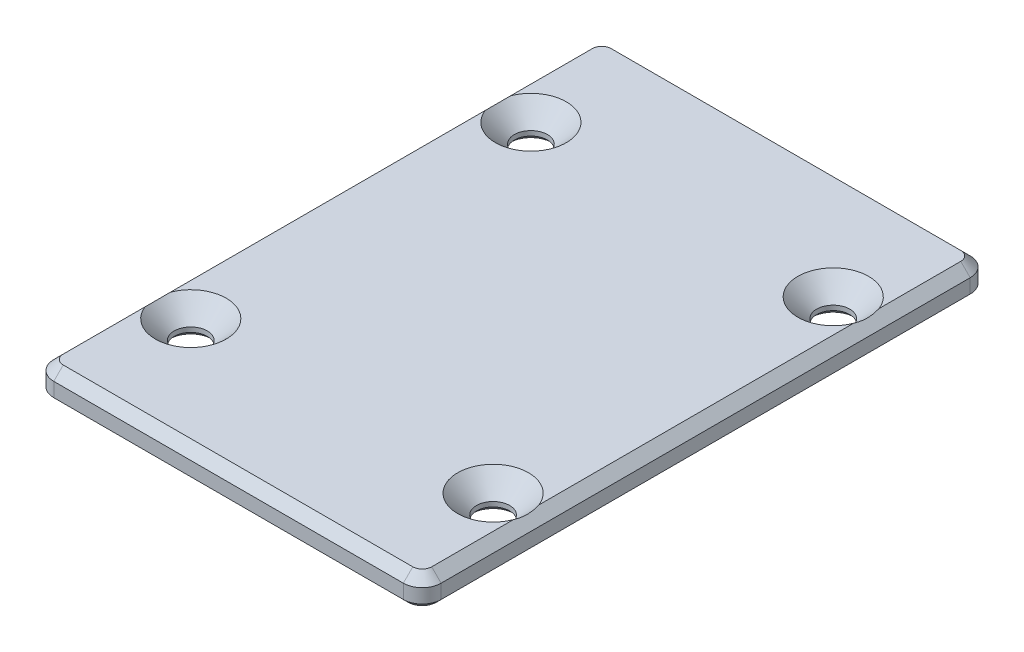
from build123d import *

# Parameters (mm, degrees)
SKETCH_1_W          = 41
SKETCH_1_H          = 60
EXTRUDE_1_DEPTH     = 3
SKETCH_2_R          = 1.75
CUT_EXTRUDE_1_DEPTH = 3
FILLET_1_R          = 2
CHAMFER_2_SIZE      = 1
CHAMFER_1_SIZE      = 2
CHAMFER_3_SIZE      = 0.5


with BuildPart() as part:
    # Эскиз1 → Бобышка-Вытянуть1 (new body)
    with BuildSketch(Plane(origin=(0, 0, 0), x_dir=(1, 0, 0), z_dir=(0, 1, 0))):
        Rectangle(SKETCH_1_W, SKETCH_1_H)
    extrude(amount=EXTRUDE_1_DEPTH)

    # Эскиз2 → Вырез-Вытянуть1 (cut)
    with BuildSketch(Plane(origin=(0, 3, 0), x_dir=(1, 0, 0), z_dir=(0, 1, 0))):
        with Locations(Location((16, 18, 0), (0, 0, 270))):
            Circle(SKETCH_2_R)
        with Locations(Location((16, -18, 0), (0, 0, 90))):
            Circle(SKETCH_2_R)
        with Locations(Location((-16, -18, 0), (0, 0, 270))):
            Circle(SKETCH_2_R)
        with Locations(Location((-16, 18, 0), (0, 0, 90))):
            Circle(SKETCH_2_R)
    extrude(amount=-CUT_EXTRUDE_1_DEPTH, mode=Mode.SUBTRACT)

    # Скругление1
    fillet_1_edges = [part.edges().sort_by_distance(p)[0] for p in [
        (20.5, 1.5, 30),
        (-20.5, 1.5, 30),
        (-20.5, 1.5, -30),
        (20.5, 1.5, -30),
    ]]
    fillet(fillet_1_edges, radius=FILLET_1_R)

    # Фаска2
    chamfer_2_edges = [part.edges().sort_by_distance(p)[0] for p in [
        (0, 3, -30),
        (20.5, 3, 0),
        (-20.5, 3, 0),
        (0, 3, 30),
        (19.914213562, 3, 29.414213562),
        (-19.914213562, 3, 29.414213562),
        (-19.914213562, 3, -29.414213562),
        (19.914213562, 3, -29.414213562),
    ]]
    chamfer(chamfer_2_edges, length=CHAMFER_2_SIZE)

    # Фаска1
    # the kernel refuses this chamfer: 2 mm, written as the material it takes off along each edge
    with BuildSketch(Plane(origin=(-16, 3, -18), x_dir=(0, 0, -1), z_dir=(1, 0, 0))) as chamfer_1_piece_1:
        Polygon((1.75 + CHAMFER_1_SIZE, 0), (1.75, -CHAMFER_1_SIZE), (1.75, 0), align=None)
    revolve(axis=Axis((-16, 3, -18), (0, 1, 0)), mode=Mode.SUBTRACT)
    with BuildSketch(Plane(origin=(-16, 3, 18), x_dir=(0, 0, 1), z_dir=(-1, 0, 0))) as chamfer_1_piece_2:
        Polygon((1.75 + CHAMFER_1_SIZE, 0), (1.75, -CHAMFER_1_SIZE), (1.75, 0), align=None)
    revolve(axis=Axis((-16, 3, 18), (0, 1, 0)), mode=Mode.SUBTRACT)
    with BuildSketch(Plane(origin=(16, 3, 18), x_dir=(0, 0, -1), z_dir=(1, 0, 0))) as chamfer_1_piece_3:
        Polygon((1.75 + CHAMFER_1_SIZE, 0), (1.75, -CHAMFER_1_SIZE), (1.75, 0), align=None)
    revolve(axis=Axis((16, 3, 18), (0, 1, 0)), mode=Mode.SUBTRACT)
    with BuildSketch(Plane(origin=(16, 3, -18), x_dir=(0, 0, 1), z_dir=(-1, 0, 0))) as chamfer_1_piece_4:
        Polygon((1.75 + CHAMFER_1_SIZE, 0), (1.75, -CHAMFER_1_SIZE), (1.75, 0), align=None)
    revolve(axis=Axis((16, 3, -18), (0, 1, 0)), mode=Mode.SUBTRACT)

    # Фаска3
    chamfer_3_edges = [part.edges().sort_by_distance(p)[0] for p in [
        (-16, 0, -16.25),
        (-16, 0, 16.25),
        (16, 0, 19.75),
        (16, 0, -19.75),
        (0, 0, -30),
        (20.5, 0, 0),
        (0, 0, 30),
        (-20.5, 0, 0),
        (19.914213562, 0, 29.414213562),
        (-19.914213562, 0, 29.414213562),
        (-19.914213562, 0, -29.414213562),
        (19.914213562, 0, -29.414213562),
    ]]
    chamfer(chamfer_3_edges, length=CHAMFER_3_SIZE)


solid = part.part
